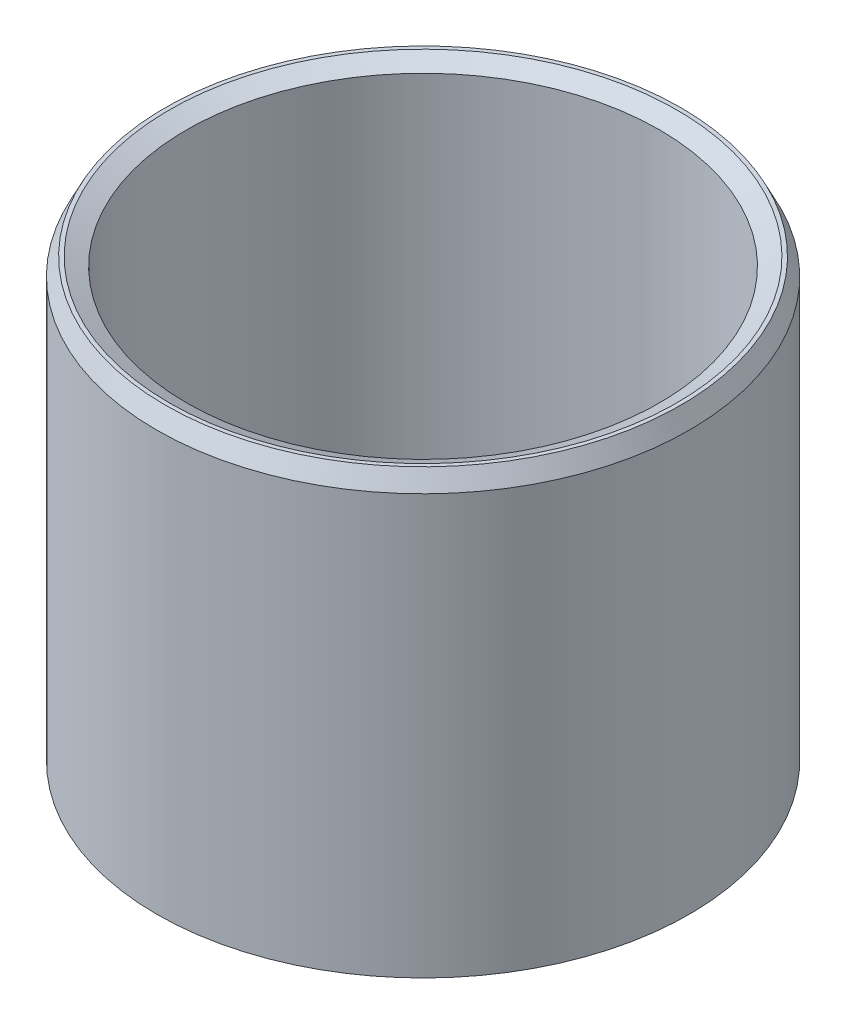
from build123d import *
from OCP.BRepFilletAPI import BRepFilletAPI_MakeChamfer

# Parameters (mm, degrees)
SKETCH1_R           = 60
BOSS_EXTRUDE1_DEPTH = 100.30173439
SKETCH2_R           = 53.276797988
CUT_EXTRUDE1_DEPTH  = 132.378985845
CHAMFER1_SIZE       = 3.895225459
CHAMFER1_SIZE2      = 1.94162444


with BuildPart() as part:
    # Sketch1 → Boss-Extrude1 (new body)
    with BuildSketch(Plane(origin=(0, 0, 0), x_dir=(1, 0, 0), z_dir=(0, 1, 0))):
        Circle(SKETCH1_R)
    extrude(amount=BOSS_EXTRUDE1_DEPTH)

    # Sketch2 → Cut-Extrude1 (cut, through all)
    with BuildSketch(Plane(origin=(0, 0, 0), x_dir=(1, 0, 0), z_dir=(0, 1, 0))):
        Circle(SKETCH2_R)
    extrude(amount=CUT_EXTRUDE1_DEPTH, mode=Mode.SUBTRACT)

    # Chamfer1: one chamfer whose edges measure the first distance from different faces: ONE call of the kernel's chamfer builder (chamfer() names one face for all edges)
    chamfer1_edges_1 = [part.edges().sort_by_distance(p)[0] for p in [
        (-53.276797988, 100.30173439, 0),
    ]]
    chamfer1_side_1 = [part.faces().sort_by_distance(p)[0] for p in [
        (-58.302943725, 100.30173439, 0),
    ]]
    chamfer1_edges_2 = [part.edges().sort_by_distance(p)[0] for p in [
        (-53.276797988, 0, 0),
    ]]
    chamfer1_side_2 = [part.faces().sort_by_distance(p)[0] for p in [
        (-53.276797988, 50.150867195, 0),
    ]]
    chamfer1_edges_3 = [part.edges().sort_by_distance(p)[0] for p in [
        (-60, 0, 0),
    ]]
    chamfer1_side_3 = [part.faces().sort_by_distance(p)[0] for p in [
        (-58.302943725, 0, 0),
    ]]
    chamfer1_edges_4 = [part.edges().sort_by_distance(p)[0] for p in [
        (-60, 100.30173439, 0),
    ]]
    chamfer1_side_4 = [part.faces().sort_by_distance(p)[0] for p in [
        (-60, 50.150867195, 0),
    ]]
    chamfer1 = BRepFilletAPI_MakeChamfer(part.part.solid().wrapped)
    for e in chamfer1_edges_1:
        chamfer1.Add(CHAMFER1_SIZE, CHAMFER1_SIZE2, e.wrapped, chamfer1_side_1[0].wrapped)  # the first distance lies on this face
    for e in chamfer1_edges_2:
        chamfer1.Add(CHAMFER1_SIZE, CHAMFER1_SIZE2, e.wrapped, chamfer1_side_2[0].wrapped)  # the first distance lies on this face
    for e in chamfer1_edges_3:
        chamfer1.Add(CHAMFER1_SIZE, CHAMFER1_SIZE2, e.wrapped, chamfer1_side_3[0].wrapped)  # the first distance lies on this face
    for e in chamfer1_edges_4:
        chamfer1.Add(CHAMFER1_SIZE, CHAMFER1_SIZE2, e.wrapped, chamfer1_side_4[0].wrapped)  # the first distance lies on this face
    add(Compound.cast(chamfer1.Shape()), mode=Mode.REPLACE)


solid = part.part
